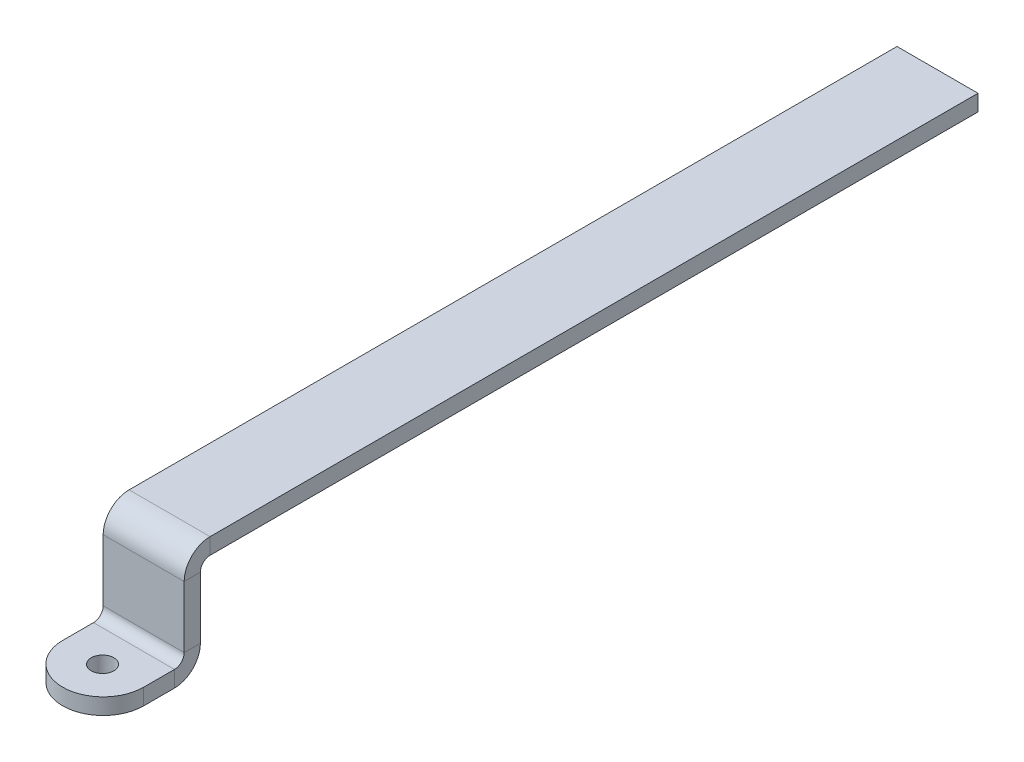
from build123d import *

# Parameters (mm, degrees)
BASE_FLANGE1_DEPTH = 0.625
FILLET1_RADIUS     = 0.625
FILLET1_LENGTH     = 0.25
HOLE1_START        = -1.5
HOLE1_OUTLINE_R    = 0.175
HOLE1_DEPTH        = 0.25


# Read off the part's stored shape, not the designer's step: Hole1
# Sheet-metal steps are written as plain solids
with BuildPart() as part:
    # Sketch1 → Base-Flange1 (new, symmetric)
    with BuildSketch(Plane(origin=(0, 0, 0), x_dir=(0, 0, -1), z_dir=(1, 0, 0))):
        with BuildLine():
            Line((12, 0), (0.15, 0))
            ThreePointArc((0.15, 0), (0.043933983, -0.043933983), (0, -0.15))
            Line((0, -0.15), (0, -1.1))
            ThreePointArc((0, -1.1), (-0.117157288, -1.382842712), (-0.4, -1.5))
            Line((-0.4, -1.5), (-1.5, -1.5))
            Line((-1.5, -1.5), (-1.5, -1.25))
            Line((-1.5, -1.25), (-0.4, -1.25))
            ThreePointArc((-0.4, -1.25), (-0.293933983, -1.206066017), (-0.25, -1.1))
            Line((-0.25, -1.1), (-0.25, -0.15))
            ThreePointArc((-0.25, -0.15), (-0.132842712, 0.132842712), (0.15, 0.25))
            Line((0.15, 0.25), (12, 0.25))
            Line((12, 0.25), (12, 0))
        make_face()
    extrude(amount=BASE_FLANGE1_DEPTH, both=True)

    # Fillet1: full round fillet: the end face becomes a half cylinder, R = half its width
    fillet1_face = Plane((0, -1.375, 1.5), x_dir=(0, -1, 0), z_dir=(0, 0, 1))  # on the end face: x along it, z out of the body
    fillet1_slab = fillet1_face.offset(-FILLET1_RADIUS / 2) * Box(FILLET1_LENGTH, 2 * FILLET1_RADIUS, FILLET1_RADIUS, mode=Mode.PRIVATE)  # the body's end, R deep
    fillet1_round = Plane((0, -1.375, 0.875), x_dir=(0, 0, 1), z_dir=(0, -1, 0)) * Cylinder(FILLET1_RADIUS, FILLET1_LENGTH, mode=Mode.PRIVATE)  # its axis R under the face
    add(fillet1_slab - fillet1_round, mode=Mode.SUBTRACT)

    # Hole1 outline → Hole1 (cut)
    with BuildSketch(Plane(origin=(0, 0, 0), x_dir=(1, 0, 0), z_dir=(0, 1, 0)).offset(HOLE1_START)):
        with Locations((0.001471382, -0.886025874)):
            Circle(HOLE1_OUTLINE_R)
    extrude(amount=HOLE1_DEPTH, mode=Mode.SUBTRACT)


solid = part.part
